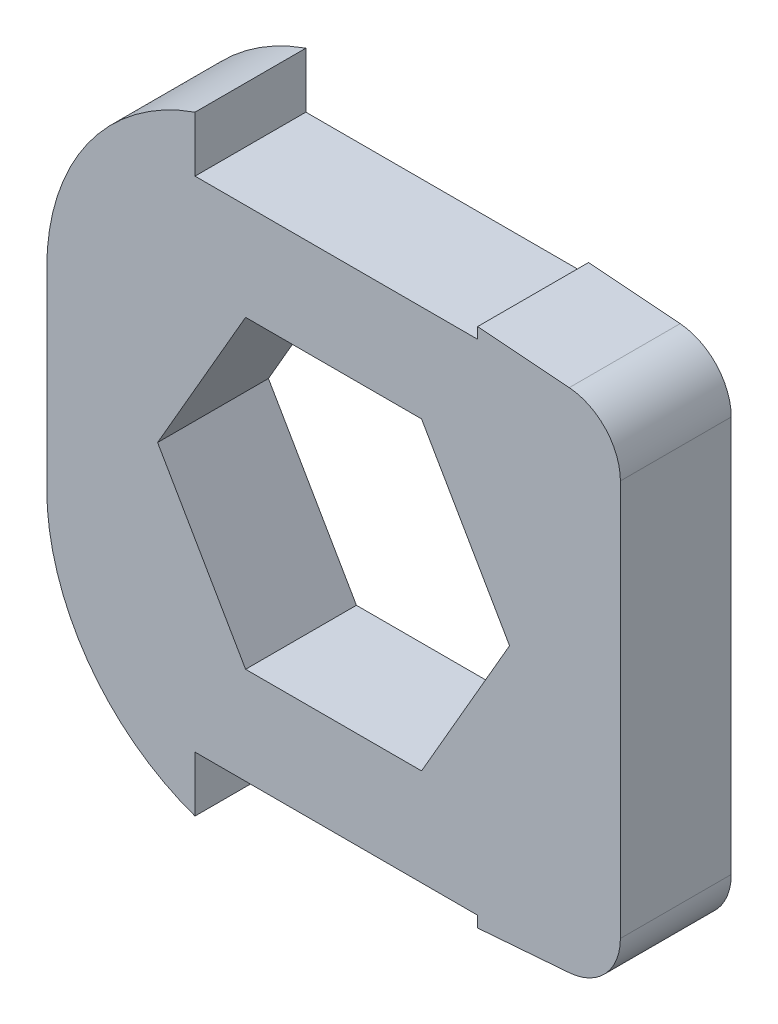
from build123d import *

# Parameters (mm, degrees)
BOSS_EXTRU_1_DEPTH = 2
CONG_1_R           = 4
CONG_2_R           = 1


with BuildPart() as part:
    # Esquisse1 → Boss.-Extru.1 (new body)
    with BuildSketch(Plane.XY):
        Polygon((0, 5.5), (2.675426481, 5.5), (2.675426481, 4.5), (7.775426481, 4.5), (7.775426481, 4.7), (10.350852961, 4.5), (10.350852961, -4.5), (7.775426481, -4.7), (7.775426481, -4.5), (2.675426481, -4.5), (2.675426481, -5.5), (0, -5.5), align=None)
        Polygon((2, 0), (3.58771324, -2.75), (6.763139721, -2.75), (8.350852961, 0), (6.763139721, 2.75), (3.58771324, 2.75), align=None, mode=Mode.SUBTRACT)
    extrude(amount=BOSS_EXTRU_1_DEPTH)

    # Congé1
    # the kernel refuses this fillet: 4 mm, written as the material it takes off along each edge
    with BuildSketch(Plane(origin=(0, -5.5, -9.435804481), x_dir=(1, 0, 0), z_dir=(0, 0, 1))) as cong_1_piece_1:
        with BuildLine():
            CenterArc((4, 3.774321792), CONG_1_R, 180, 70.661811314)
            Line((0, 3.774321792), (-0.08, 3.774321792))
            Line((-0.08, 3.774321792), (-0.08, 0))
            Line((-0.08, 0), (0, -0.08))
            ThreePointArc((0, -0.08), (1.33771324, -0.08), (2.64893501, -0.075486436))
            Line((2.64893501, -0.075486436), (2.675426481, 0))
        make_face()
    extrude(amount=20.871608961, mode=Mode.SUBTRACT)
    with BuildSketch(Plane(origin=(0, 5.5, -9.435804481), x_dir=(1, 0, 0), z_dir=(0, 0, 1))) as cong_1_piece_2:
        with BuildLine():
            CenterArc((4, -3.774321792), CONG_1_R, 109.338188686, 70.661811314)
            Line((0, -3.774321792), (-0.08, -3.774321792))
            Line((-0.08, -3.774321792), (-0.08, 0))
            Line((-0.08, 0), (0, 0.08))
            ThreePointArc((0, 0.08), (1.33771324, 0.08), (2.64893501, 0.075486436))
            Line((2.64893501, 0.075486436), (2.675426481, 0))
        make_face()
    extrude(amount=20.871608961, mode=Mode.SUBTRACT)

    # Congé2
    cong_2_edges = [part.edges().sort_by_distance(p)[0] for p in [
        (10.350852961, 4.5, 1),
        (10.350852961, -4.5, 1),
    ]]
    fillet(cong_2_edges, radius=CONG_2_R)


solid = part.part
